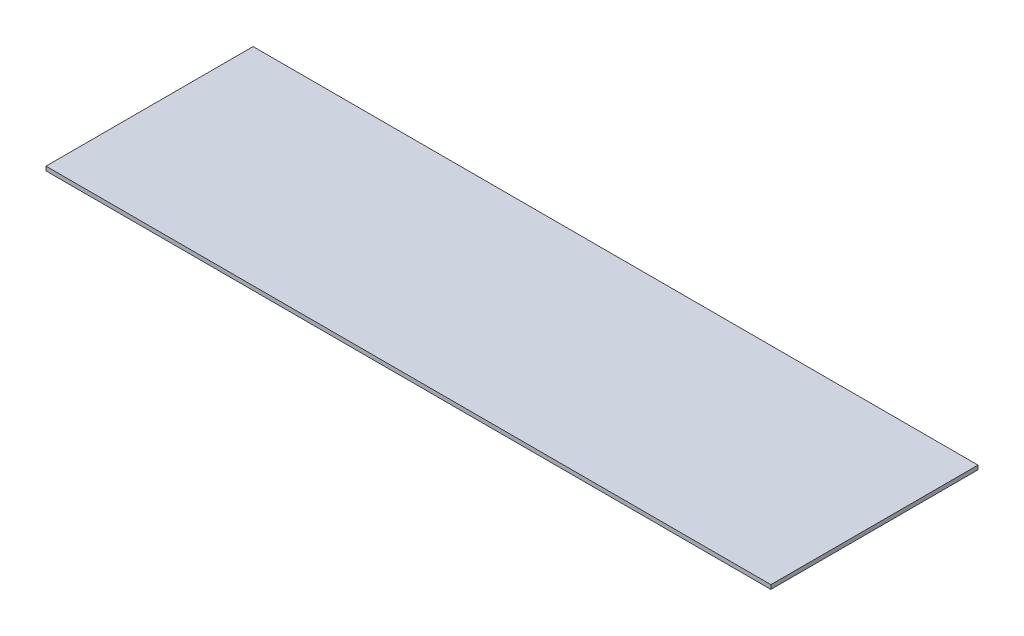
from build123d import *

# Parameters (mm, degrees)
SKETCH1_W           = 140
SKETCH1_H           = 40
BOSS_EXTRUDE1_DEPTH = 0.8


with BuildPart() as part:
    # Sketch1 → Boss-Extrude1 (new body)
    with BuildSketch(Plane(origin=(0, 0, 0), x_dir=(1, 0, 0), z_dir=(0, 1, 0))):
        Rectangle(SKETCH1_W, SKETCH1_H)
    extrude(amount=BOSS_EXTRUDE1_DEPTH)


solid = part.part
